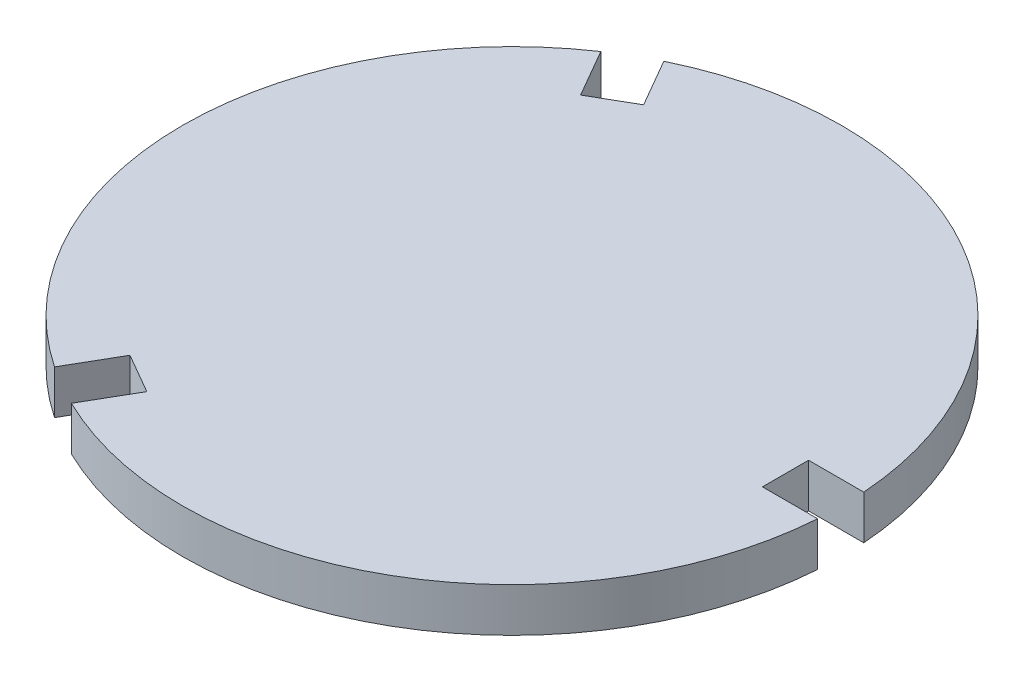
from build123d import *

# Parameters (mm, degrees)
CROQUIS1_R              = 30
SALIENTE_EXTRUIR1_DEPTH = 4
CORTAR_EXTRUIR2_REACH   = 44.615
CROQUIS2_W              = 10.2
CROQUIS2_H              = 4.2
MATRIZC1_COUNT          = 3


with BuildPart() as part:
    # Croquis1 → Saliente-Extruir1 (new body)
    with BuildSketch(Plane(origin=(0, 0, 0), x_dir=(1, 0, 0), z_dir=(0, 1, 0))):
        Circle(CROQUIS1_R)
    extrude(amount=SALIENTE_EXTRUIR1_DEPTH)

    # Croquis2 → Cortar-Extruir2 (cut, up to next)
    with BuildSketch(Plane(origin=(0, 0, 0), x_dir=(1, 0, 0), z_dir=(0, 1, 0)), mode=Mode.PRIVATE) as cortar_extruir2_sk1:
        with Locations((30, 0)):
            Rectangle(CROQUIS2_W, CROQUIS2_H)
    cortar_extruir2_tool1 = extrude(cortar_extruir2_sk1.sketch, amount=CORTAR_EXTRUIR2_REACH, mode=Mode.PRIVATE) & part.part
    cortar_extruir2 = cortar_extruir2_tool1.solids().sort_by_distance((30, 0, 0))[0]
    add(cortar_extruir2, mode=Mode.SUBTRACT)

    # MatrizC1: Cortar-Extruir2 ×3 about axis
    matrizc1_axis = Axis((0, -0.25, 0), (0, 1, 0))
    for i in range(1, MATRIZC1_COUNT):
        add(cortar_extruir2.rotate(matrizc1_axis, i * 360 / MATRIZC1_COUNT), mode=Mode.SUBTRACT)


solid = part.part
